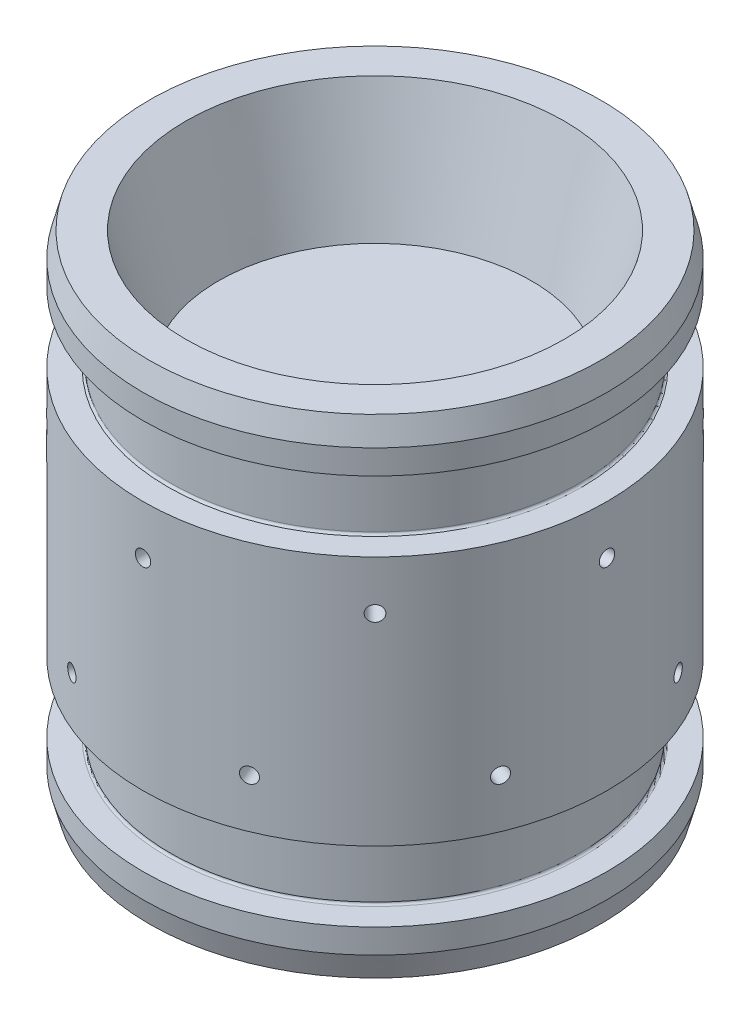
from build123d import *

# Parameters (mm, degrees)
SKETCH1_R                    = 24.1554
BODY_DEPTH                   = 25.4
SKETCH2_R                    = 15.875
LIGHTENING_HOLE_DEPTH        = 12.7
INSTALL_CHAMFER_SIZE         = 2.54
INSTALL_CHAMFER_SIZE2        = 0.680590949
PROP_CHAMFER_SIZE            = 3.81
PROP_CHAMFER_SIZE_2          = 14.219113577
BOT_INSTALL_CHAMFER_SIZE     = 2.54
BOT_INSTALL_CHAMFER_SIZE2    = 0.680590949
BOT_PROP_CHAMFER_SIZE        = 3.81
BOT_PROP_CHAMFER_SIZE_2      = 14.219113577
TAPPED_HOLE_PATTERN_8X_COUNT = 8


with BuildPart() as part:
    # Sketch1 → body (new, symmetric)
    with BuildSketch(Plane(origin=(0, 0, 0), x_dir=(1, 0, 0), z_dir=(0, 1, 0))):
        with Locations(Location((0, 0, 0), (0, 0, 270))):
            Circle(SKETCH1_R)
    extrude(amount=BODY_DEPTH, both=True)

    # Sketch2 → lightening hole (cut)
    with BuildSketch(Plane(origin=(0, 25.4, 0), x_dir=(1, 0, 0), z_dir=(0, 1, 0))):
        with Locations(Location((0, 0, 0), (0, 0, 270))):
            Circle(SKETCH2_R)
    lightening_hole = extrude(amount=-LIGHTENING_HOLE_DEPTH, mode=Mode.SUBTRACT)

    # main-o-ring → o-ring-main (with backup rings) (revolve, cut)
    with BuildSketch(Plane.XY, mode=Mode.PRIVATE) as o_ring_main_with_backup_rings_sk:
        with BuildLine():
            Line((-24.1554, 20.32), (-24.1554, 13.0302))
            Line((-24.1554, 13.0302), (-21.550812385, 13.0302))
            ThreePointArc((-21.550812385, 13.0302), (-21.380956579, 13.100556579), (-21.3106, 13.270412385))
            Line((-21.3106, 13.270412385), (-21.3106, 20.079787615))
            ThreePointArc((-21.3106, 20.079787615), (-21.380956579, 20.249643421), (-21.550812385, 20.32))
            Line((-21.550812385, 20.32), (-24.1554, 20.32))
        make_face()
    o_ring_main_with_backup_rings = revolve(o_ring_main_with_backup_rings_sk.sketch.rotate(Axis((0, 0, 0), (0, 1, 0)), 270), axis=Axis((0, 0, 0), (0, 1, 0)), mode=Mode.SUBTRACT)

    # install-chamfer
    install_chamfer_edges = [part.edges().sort_by_distance(p)[0] for p in [
        (0, 25.4, -24.1554),
    ]]
    install_chamfer_side = [part.faces().sort_by_distance(p)[0] for p in [
        (0, 22.86, -24.1554),
    ]]
    chamfer(install_chamfer_edges, length=INSTALL_CHAMFER_SIZE, length2=INSTALL_CHAMFER_SIZE2, reference=install_chamfer_side[0])

    # prop-chamfer
    # the kernel refuses this chamfer: 14.219113577, 3.81 mm, written as the material it takes off along each edge
    with BuildSketch(Plane(origin=(0, 25.4, 0), x_dir=(0, 0, 1), z_dir=(-1, 0, 0))) as prop_chamfer_piece_1_section:
        Polygon((15.875 + PROP_CHAMFER_SIZE, 0), (15.875, -PROP_CHAMFER_SIZE_2), (15.875, 0), align=None)
    prop_chamfer_piece_1 = revolve(axis=Axis((0, 25.4, 0), (0, 1, 0)), mode=Mode.PRIVATE)
    prop_chamfer_piece_1 = split(prop_chamfer_piece_1, bisect_by=Plane(origin=(0, 12.7, -17.911519762), z_dir=(0, 1, 0)), keep=Keep.TOP, mode=Mode.PRIVATE)
    add(prop_chamfer_piece_1, mode=Mode.SUBTRACT)

    # Top-Bottom Symmetry: lightening hole, o-ring-main (with backup rings) across plane
    add(lightening_hole.mirror(Plane.ZX), mode=Mode.SUBTRACT)
    add(o_ring_main_with_backup_rings.mirror(Plane.ZX), mode=Mode.SUBTRACT)

    # bot-install-chamfer
    bot_install_chamfer_edges = [part.edges().sort_by_distance(p)[0] for p in [
        (0, -25.4, -24.1554),
    ]]
    bot_install_chamfer_side = [part.faces().sort_by_distance(p)[0] for p in [
        (0, -22.86, -24.1554),
    ]]
    chamfer(bot_install_chamfer_edges, length=BOT_INSTALL_CHAMFER_SIZE, length2=BOT_INSTALL_CHAMFER_SIZE2, reference=bot_install_chamfer_side[0])

    # bot-prop-chamfer
    # the kernel refuses this chamfer: 14.219113577, 3.81 mm, written as the material it takes off along each edge
    with BuildSketch(Plane(origin=(0, -25.4, 0), x_dir=(0, 0, 1), z_dir=(-1, 0, 0))) as bot_prop_chamfer_piece_1_section:
        Polygon((15.875 + BOT_PROP_CHAMFER_SIZE, 0), (15.875, BOT_PROP_CHAMFER_SIZE_2), (15.875, 0), align=None)
    bot_prop_chamfer_piece_1 = revolve(axis=Axis((0, -25.4, 0), (0, 1, 0)), mode=Mode.PRIVATE)
    bot_prop_chamfer_piece_1 = split(bot_prop_chamfer_piece_1, bisect_by=Plane(origin=(0, -12.7, -17.911519762), z_dir=(0, -1, 0)), keep=Keep.TOP, mode=Mode.PRIVATE)
    add(bot_prop_chamfer_piece_1, mode=Mode.SUBTRACT)

    # Sketch3 → M2x0.4 Tapped Hole (top) (revolve, cut)
    with BuildSketch(Plane(origin=(-24.1554, 7.9375, 0), x_dir=(0, 0, 1), z_dir=(0, 1, 0))):
        Polygon((0, 0), (0, 7.237088495), (0.8, 6.7564), (0.8, 0), align=None)
    m2x0_4_tapped_hole_top = revolve(axis=Axis((-30.5054, 7.9375, 0), (1, 0, 0)), mode=Mode.SUBTRACT)

    # Sketch4 → M2x0.4 Tapped Hole (bottom) (revolve, cut)
    with BuildSketch(Plane(origin=(-22.31667966, -7.9375, -9.243871382), x_dir=(-0.38268343236509006, 0, 0.9238795325112867), z_dir=(0, 1, 0))):
        Polygon((0, 0), (0, 7.237088495), (0.8, 6.7564), (0.8, 0), align=None)
    m2x0_4_tapped_hole_bottom = revolve(axis=Axis((-28.183314691, -7.9375, -11.673911178), (0.9238795325112866, 0, 0.38268343236509)), mode=Mode.SUBTRACT)

    # Tapped Hole Pattern (8X): M2x0.4 Tapped Hole (top), M2x0.4 Tapped Hole (bottom) ×8 about axis
    tapped_hole_pattern_8x_axis = Axis((0, 25.4, 0), (0, -1, 0))
    add([m2x0_4_tapped_hole_top.rotate(tapped_hole_pattern_8x_axis, i * 360 / TAPPED_HOLE_PATTERN_8X_COUNT) for i in range(1, TAPPED_HOLE_PATTERN_8X_COUNT)], mode=Mode.SUBTRACT)
    add([m2x0_4_tapped_hole_bottom.rotate(tapped_hole_pattern_8x_axis, i * 360 / TAPPED_HOLE_PATTERN_8X_COUNT) for i in range(1, TAPPED_HOLE_PATTERN_8X_COUNT)], mode=Mode.SUBTRACT)


solid = part.part
